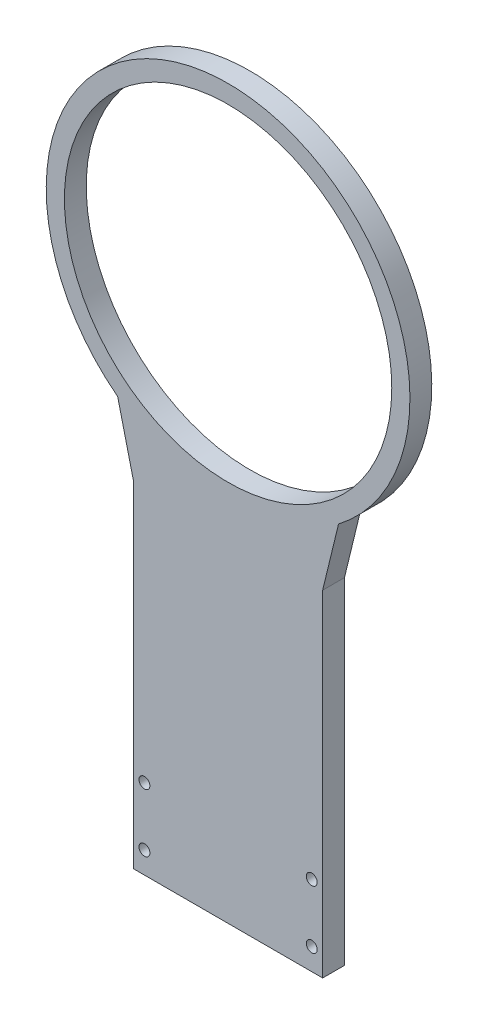
from build123d import *

# Parameters (mm, degrees)
ESQUISSE1_W             = 100
ESQUISSE1_H             = 100
BOSS_EXTRU_1_DEPTH      = 6
ESQUISSE2_R             = 45
ENL_V_MAT_EXTRU_1_DEPTH = 142.548578234
ESQUISSE3_W             = 100
ESQUISSE3_H             = 100
BOSS_EXTRU_2_DEPTH      = 6
ESQUISSE4_W             = 24
ESQUISSE4_H             = 100
ENL_V_MAT_EXTRU_2_DEPTH = 6
ESQUISSE5_R             = 1.5
ENL_V_MAT_EXTRU_3_DEPTH = 142.548578234
ENL_V_MAT_EXTRU_4_DEPTH = 142.548578234
CHANFREIN1_SIZE         = 14.962611718


with BuildPart() as part:
    # Esquisse1 → Boss.-Extru.1 (new body)
    with BuildSketch(Plane.XY):
        with Locations((50, 50)):
            Rectangle(ESQUISSE1_W, ESQUISSE1_H)
    extrude(amount=BOSS_EXTRU_1_DEPTH)

    # Esquisse2 → Enlèv. mat.-Extru.1 (cut, through all)
    with BuildSketch(Plane.XY.offset(6)):
        with Locations((50, 50)):
            Circle(ESQUISSE2_R)
    extrude(amount=-ENL_V_MAT_EXTRU_1_DEPTH, mode=Mode.SUBTRACT)

    # Esquisse3 → Boss.-Extru.2 (add)
    with BuildSketch(Plane.XY.offset(6)):
        with Locations((50, -50)):
            Rectangle(ESQUISSE3_W, ESQUISSE3_H)
    extrude(amount=-BOSS_EXTRU_2_DEPTH)

    # Esquisse4 → Enlèv. mat.-Extru.2 (cut)
    with BuildSketch(Plane.XY.offset(6)):
        with Locations((12, -50)):
            Rectangle(ESQUISSE4_W, ESQUISSE4_H)
        with Locations((88, -50)):
            Rectangle(ESQUISSE4_W, ESQUISSE4_H)
    extrude(amount=-ENL_V_MAT_EXTRU_2_DEPTH, mode=Mode.SUBTRACT)

    # Esquisse5 → Enlèv. mat.-Extru.3 (cut, through all)
    with BuildSketch(Plane.XY.offset(6)):
        with Locations((27, -78)):
            Circle(ESQUISSE5_R)
        with Locations((27, -94)):
            Circle(ESQUISSE5_R)
        with Locations(Location((73, -94, 0), (0, 0, 180))):
            Circle(ESQUISSE5_R)
        with Locations(Location((73, -78, 0), (0, 0, 180))):
            Circle(ESQUISSE5_R)
    extrude(amount=-ENL_V_MAT_EXTRU_3_DEPTH, mode=Mode.SUBTRACT)

    # Esquisse6 → Enlèv. mat.-Extru.4 (cut, through all)
    with BuildSketch(Plane.XY.offset(6)):
        with BuildLine():
            Line((76, 7.291686992), (76, 0))
            Line((76, 0), (101, 0))
            Line((101, 0), (101, 101))
            Line((101, 101), (-1, 101))
            Line((-1, 101), (-1, 0))
            Line((-1, 0), (24, 0))
            Line((24, 0), (24, 7.291686992))
            ThreePointArc((24, 7.291686992), (50, 100), (76, 7.291686992))
        make_face()
    extrude(amount=-ENL_V_MAT_EXTRU_4_DEPTH, mode=Mode.SUBTRACT)

    # Chanfrein1
    # the kernel refuses this chamfer: 14.962611718, 5 mm, written as the material it adds along each edge
    with BuildSketch(Plane(origin=(76, 7.291686992, 6), x_dir=(0.8254797465203109, 0.564431739083446, 0), z_dir=(0, 0, -1))) as chanfrein1_piece_1:
        with BuildLine():
            Line((5.28690795, 0), (-CHANFREIN1_SIZE * 0.564431739076, CHANFREIN1_SIZE * 0.825479746509))
            Line((-CHANFREIN1_SIZE * 0.564431739076, CHANFREIN1_SIZE * 0.825479746509), (0, 0))
            ThreePointArc((0, 0), (2.867154561, 0.069426966), (5.28690795, 0))
        make_face()
    extrude(amount=6)
    with BuildSketch(Plane(origin=(24, 7.291686992, 6), x_dir=(-0.8254797465203098, 0.5644317390834476, 0), z_dir=(0, 0, -1))) as chanfrein1_piece_2:
        with BuildLine():
            Line((5.28690795, 0), (-CHANFREIN1_SIZE * 0.564431739076, -CHANFREIN1_SIZE * 0.825479746509))
            Line((-CHANFREIN1_SIZE * 0.564431739076, -CHANFREIN1_SIZE * 0.825479746509), (0, 0))
            ThreePointArc((0, 0), (2.867154561, -0.069426966), (5.28690795, 0))
        make_face()
    extrude(amount=6)


solid = part.part
